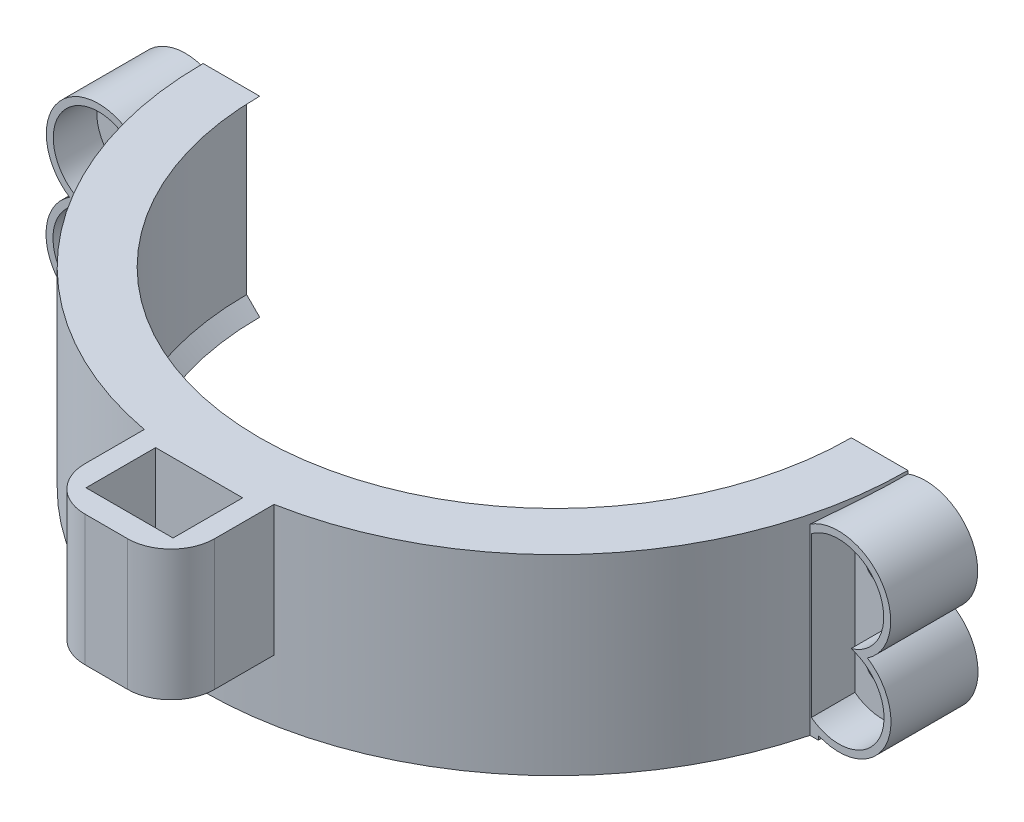
from build123d import *

# Parameters (mm, degrees)
REVOLVE1_ANGLE                  = 180
BOSS_EXTRUDE1_START             = -11
BOSS_EXTRUDE1_DEPTH             = 11
CUT_EXTRUDE1_REACH              = 68.374
BOSS_EXTRUDE2_REACH             = 67.327
BOSS_EXTRUDE2_END_RADIUS        = 40.5
SKETCH6_W                       = 25.4
SKETCH6_H                       = 18
BOSS_EXTRUDE2_DIRECTION_2_DEPTH = 15
SKETCH8_W                       = 4
SKETCH8_H                       = 19.884534
CUT_EXTRUDE3_DEPTH              = 80.722348
FILLET1_START                   = 2
FILLET1_DEPTH                   = 5
FILLET1_START_2                 = -11
FILLET1_2_DEPTH                 = 16.09884
FILLET1_START_3                 = 37
FILLET1_3_DEPTH                 = 28
FILLET1_START_4                 = 62
FILLET1_4_OUTLINE_W             = 4
FILLET1_4_OUTLINE_H             = 5
FILLET1_4_DEPTH                 = 3
FILLET1_START_5                 = 39.17071
FILLET1_5_OUTLINE_W             = 4
FILLET1_5_OUTLINE_H             = 5
FILLET1_5_DEPTH                 = 2.944756
FILLET1_6_DEPTH                 = 6
SKETCH9_R                       = 2
BOSS_EXTRUDE3_DEPTH             = 10
CUT_EXTRUDE4_DEPTH              = 75.187772
CUT_EXTRUDE4_DEPTH_BACK         = 5
CUT_EXTRUDE5_DEPTH              = 85.064413
SKETCH12_W                      = 14.911662
SKETCH12_H                      = 13.358131
SKETCH12_W_2                    = 10
SKETCH12_H_2                    = 8
BOSS_EXTRUDE4_DEPTH             = 15
FILLET2_R                       = 5


with BuildPart() as part:
    # Sketch2 → Revolve1 (revolve, symmetric)
    with BuildSketch(Plane(origin=(0, 0, 0), x_dir=(0, 0, -1), z_dir=(1, 0, 0))) as revolve1_sk:
        Polygon((-34, -11), (-35.5, -9.5), (-35.5, 9.5), (-34, 11), (-35.5, 11), (-40.5, 11), (-40.5, -11), (-35.5, -11), align=None)
    revolve(axis=Axis((0, 0, 0), (0, 1, 0)), revolution_arc=REVOLVE1_ANGLE / 2)
    revolve(revolve1_sk.sketch, axis=Axis((0, 0, 0), (0, -1, 0)), revolution_arc=REVOLVE1_ANGLE / 2)

    # Sketch3 → Boss-Extrude1 (add)
    with BuildSketch(Plane(origin=(0, 0, 0), x_dir=(1, 0, 0), z_dir=(0, 1, 0)).offset(BOSS_EXTRUDE1_START)):
        with BuildLine():
            ThreePointArc((-40.5, 0), (0, -40.5), (40.5, 0))
            add(Edge.make_bspline(
                [(40.5, 0), (41.574904, -20.679763), (31.861074, -51.110818), (0, -51.360442)],
                knots=[0, 0, 0, 0, 1, 1, 1, 1], degree=3))
            add(Edge.make_bspline(
                [(-40.5, 0), (-41.574904, -20.679763), (-31.861074, -51.110818), (0, -51.360442)],
                knots=[0, 0, 0, 0, 1, 1, 1, 1], degree=3))
        make_face()
    extrude(amount=BOSS_EXTRUDE1_DEPTH)

    # Sketch5 → Cut-Extrude1 (cut, up to next)
    with BuildSketch(Plane(origin=(0, 0, 0), x_dir=(1, 0, 0), z_dir=(0, 1, 0)), mode=Mode.PRIVATE) as cut_extrude1_sk1:
        Polygon((32.298595, -50), (-32.298595, -50), (-4.520904, -70.798059), align=None)
    cut_extrude1_tool1 = extrude(cut_extrude1_sk1.sketch, amount=-CUT_EXTRUDE1_REACH, mode=Mode.PRIVATE) & part.part
    add(cut_extrude1_tool1.solids().sort_by_distance((-1.506968, 0, 56.932686))[0], mode=Mode.SUBTRACT)

    # Boss-Extrude2: up to this cylinder (the profile starts outside it)
    boss_extrude2_end = Plane(origin=(0, -2, 0), z_dir=(0, -1, 0)) * Cylinder(BOSS_EXTRUDE2_END_RADIUS, 216.654, mode=Mode.PRIVATE)
    # Sketch6 → Boss-Extrude2 (add, up to the surface)
    with BuildSketch(Plane.XY.offset(50), mode=Mode.PRIVATE) as boss_extrude2_sk1:
        with Locations((0, -2)):
            Rectangle(SKETCH6_W, SKETCH6_H)
    boss_extrude2_tool1 = extrude(boss_extrude2_sk1.sketch, amount=-BOSS_EXTRUDE2_REACH, mode=Mode.PRIVATE) - boss_extrude2_end
    add(boss_extrude2_tool1.solids().sort_by_distance((0, -2, 50))[0])

    # Sketch6 → Boss-Extrude2 direction 2 (add)
    with BuildSketch(Plane.XY.offset(50)):
        with Locations((0, -2)):
            Rectangle(SKETCH6_W, SKETCH6_H)
    extrude(amount=BOSS_EXTRUDE2_DIRECTION_2_DEPTH)

    # Sketch8 → Cut-Extrude3 (cut, through all)
    with BuildSketch(Plane(origin=(0, 11, 0), x_dir=(1, 0, 0), z_dir=(0, 1, 0))):
        with BuildLine():
            Line((15.113165, -40.129156), (15.113165, -45.006528))
            add(Edge.make_bspline(
                [(15.113165, -45.006528), (20.553217, -43.096096), (30.745136, -32.716473), (33.442003, -26.840069)],
                knots=[0, 0, 0, 0, 1, 1, 1, 1], degree=3))
            ThreePointArc((33.442003, -26.840069), (25.17044, -34.716075), (15.113165, -40.129156))
        make_face()
        with BuildLine():
            Line((-15.113165, -40.129156), (-15.113165, -45.006528))
            add(Edge.make_bspline(
                [(-15.113165, -45.006528), (-20.553217, -43.096096), (-30.745136, -32.716473), (-33.442003, -26.840069)],
                knots=[0, 0, 0, 0, 1, 1, 1, 1], degree=3))
            ThreePointArc((-33.442003, -26.840069), (-25.17044, -34.716075), (-15.113165, -40.129156))
        make_face()
        with Locations((0, -52.057733)):
            Rectangle(SKETCH8_W, SKETCH8_H)
    extrude(amount=-CUT_EXTRUDE3_DEPTH, mode=Mode.SUBTRACT)

    # Fillet1: read off the stored shape, not the designer's step
    # Fillet1 outline → Fillet1 (cut)
    with BuildSketch(Plane(origin=(0, 0, 0), x_dir=(1, 0, 0), z_dir=(0, 1, 0)).offset(FILLET1_START)):
        with BuildLine():
            Line((-12.7, -65), (12.7, -65))
            Line((12.7, -65), (12.7, -38.457249))
            ThreePointArc((12.7, -38.457249), (0, -40.5), (-12.7, -38.457249))
            Line((-12.7, -38.457249), (-12.7, -65))
        make_face()
    extrude(amount=FILLET1_DEPTH, mode=Mode.SUBTRACT)

    # Fillet1 2 outline → Fillet1 2 (cut)
    with BuildSketch(Plane(origin=(0, 0, 0), x_dir=(1, 0, 0), z_dir=(0, 1, 0)).offset(FILLET1_START_2)):
        with BuildLine():
            Line((-12.7, -65), (-7.7, -65))
            add(Edge.make_bspline(
                [(-7.7, -65), (-12.7, -65), (-12.7, -60)],
                knots=[0, 0, 0, 1, 1, 1], degree=2, weights=[1, 0.707107, 1]))
            Line((-12.7, -60), (-12.7, -65))
        make_face()
        with BuildLine():
            add(Edge.make_bspline(
                [(7.7, -65), (12.7, -65), (12.7, -60)],
                knots=[0, 0, 0, 1, 1, 1], degree=2, weights=[1, 0.707107, 1]))
            Line((7.7, -65), (12.7, -65))
            Line((12.7, -65), (12.7, -60))
        make_face()
    extrude(amount=FILLET1_2_DEPTH, mode=Mode.SUBTRACT)

    # Fillet1 3 outline → Fillet1 3 (add)
    with BuildSketch(Plane.XY.offset(FILLET1_START_3)):
        with BuildLine():
            add(Edge.make_bspline(
                [(-12.7, 2), (-12.7, 7), (-7.7, 7)],
                knots=[0, 0, 0, 1, 1, 1], degree=2, weights=[1, 0.707107, 1]))
            Line((-12.7, 2), (-2, 2))
            Line((-2, 2), (-2, 7))
            Line((-2, 7), (-7.7, 7))
        make_face()
        with BuildLine():
            Line((2, 7), (2, 2))
            Line((2, 2), (12.7, 2))
            add(Edge.make_bspline(
                [(7.7, 7), (12.7, 7), (12.7, 2)],
                knots=[0, 0, 0, 1, 1, 1], degree=2, weights=[1, 0.707107, 1]))
            Line((7.7, 7), (2, 7))
        make_face()
    extrude(amount=FILLET1_3_DEPTH)

    # Fillet1 4 outline → Fillet1 4 (add)
    with BuildSketch(Plane.XY.offset(FILLET1_START_4)):
        with Locations((0, 4.5)):
            Rectangle(FILLET1_4_OUTLINE_W, FILLET1_4_OUTLINE_H)
    extrude(amount=FILLET1_4_DEPTH)

    # Fillet1 5 outline → Fillet1 5 (add)
    with BuildSketch(Plane.XY.offset(FILLET1_START_5)):
        with Locations((0, 4.5)):
            Rectangle(FILLET1_5_OUTLINE_W, FILLET1_5_OUTLINE_H)
    extrude(amount=FILLET1_5_DEPTH)

    # Fillet1 6 outline → Fillet1 6 (cut)
    with BuildSketch(Plane(origin=(0, 0, 0), x_dir=(1, 0, 0), z_dir=(0, 1, 0)).offset(FILLET1_START)):
        with BuildLine():
            Line((-12.7, -65), (-7.7, -65))
            add(Edge.make_bspline(
                [(-12.7, -60), (-12.7, -60.274102), (-12.679965, -60.548369), (-12.639842, -60.820553), (-12.536378, -61.284433), (-12.482162, -61.478121), (-12.41762, -61.668662), (-12.288664, -61.991396), (-12.22893, -62.125441), (-12.163988, -62.25706), (-11.922281, -62.702191), (-11.720174, -63.002028), (-11.490067, -63.281001), (-10.981001, -63.790067), (-10.702028, -64.020174), (-10.402191, -64.222281), (-9.95706, -64.463988), (-9.825441, -64.52893), (-9.691396, -64.588664), (-9.368662, -64.71762), (-9.178121, -64.782162), (-8.984433, -64.836378), (-8.520553, -64.939842), (-8.248369, -64.979965), (-7.974102, -65), (-7.7, -65)],
                knots=[0, 0, 0, 0, 0, 0.139857, 0.139857, 0.139857, 0.242164, 0.242164, 0.242164, 0.316823, 0.316823, 0.316823, 0.5, 0.5, 0.5, 0.683177, 0.683177, 0.683177, 0.757836, 0.757836, 0.757836, 0.860143, 0.860143, 0.860143, 1, 1, 1, 1, 1], degree=4))
            Line((-12.7, -60), (-12.7, -65))
        make_face()
        with BuildLine():
            Line((12.7, -65), (12.7, -60))
            add(Edge.make_bspline(
                [(12.7, -60), (12.7, -60.274102), (12.679965, -60.548369), (12.639842, -60.820553), (12.536378, -61.284433), (12.482162, -61.478121), (12.41762, -61.668662), (12.288664, -61.991396), (12.22893, -62.125441), (12.163988, -62.25706), (11.922281, -62.702191), (11.720174, -63.002028), (11.490067, -63.281001), (10.981001, -63.790067), (10.702028, -64.020174), (10.402191, -64.222281), (9.95706, -64.463988), (9.825441, -64.52893), (9.691396, -64.588664), (9.368662, -64.71762), (9.178121, -64.782162), (8.984433, -64.836378), (8.520553, -64.939842), (8.248369, -64.979965), (7.974102, -65), (7.7, -65)],
                knots=[0, 0, 0, 0, 0, 0.139857, 0.139857, 0.139857, 0.242164, 0.242164, 0.242164, 0.316823, 0.316823, 0.316823, 0.5, 0.5, 0.5, 0.683177, 0.683177, 0.683177, 0.757836, 0.757836, 0.757836, 0.860143, 0.860143, 0.860143, 1, 1, 1, 1, 1], degree=4))
            Line((7.7, -65), (12.7, -65))
        make_face()
    extrude(amount=FILLET1_6_DEPTH, mode=Mode.SUBTRACT)

    # Sketch9 → Boss-Extrude3 (add)
    # profile 1 of 2: a face of its own
    with BuildSketch(Plane.XY):
        with BuildLine():
            ThreePointArc((39.222943, -0.011905), (42.578982, -10.999961), (45.856052, 0.011905))
            ThreePointArc((45.856052, 0.011905), (42.500013, 10.999961), (39.222943, -0.011905))
        make_face()
        with Locations((42.557445, -5)):
            Circle(SKETCH9_R, mode=Mode.SUBTRACT)
        with Locations((42.52155, 5)):
            Circle(SKETCH9_R, mode=Mode.SUBTRACT)
    # profile 2 of 2: a face of its own
    with BuildSketch(Plane.XY):
        with BuildLine():
            ThreePointArc((-39.222943, -0.011905), (-42.578982, -10.999961), (-45.856052, 0.011905))
            ThreePointArc((-45.856052, 0.011905), (-42.500013, 10.999961), (-39.222943, -0.011905))
        make_face()
        with Locations(Location((-42.557445, -5, 0), (0, 0, 180))):
            Circle(SKETCH9_R, mode=Mode.SUBTRACT)
        with Locations(Location((-42.52155, 5, 0), (0, 0, 180))):
            Circle(SKETCH9_R, mode=Mode.SUBTRACT)
    extrude(amount=BOSS_EXTRUDE3_DEPTH)

    # Sketch10 → Cut-Extrude4 (cut, two sides: drawn at the far end of the back side and taken through both)
    with BuildSketch(Plane.XY.offset(10).offset(-CUT_EXTRUDE4_DEPTH_BACK)):
        with BuildLine():
            Line((39.407769, -9.137577), (39.407769, 9.164657))
            ThreePointArc((39.407769, 9.164657), (47.176604, 7.317427), (43.967661, 0.005126))
            ThreePointArc((43.967661, 0.005126), (47.210797, -7.320844), (39.407769, -9.137577))
        make_face()
        with BuildLine():
            Line((-39.407769, -9.137577), (-39.407769, 9.164657))
            ThreePointArc((-39.407769, 9.164657), (-47.176604, 7.317427), (-43.967661, 0.005126))
            ThreePointArc((-43.967661, 0.005126), (-47.210797, -7.320844), (-39.407769, -9.137577))
        make_face()
    extrude(amount=CUT_EXTRUDE4_DEPTH + CUT_EXTRUDE4_DEPTH_BACK, mode=Mode.SUBTRACT)

    # Sketch11 → Cut-Extrude5 (cut, through all)
    with BuildSketch(Plane(origin=(0, 11, 0), x_dir=(1, 0, 0), z_dir=(0, 1, 0))):
        with BuildLine():
            Line((48.52155, -10), (39.246019, -10))
            ThreePointArc((39.246019, -10), (0, -40.5), (-39.246019, -10))
            Line((-39.246019, -10), (-48.52155, -10))
            Line((-48.52155, -10), (-48.52155, -69.748878))
            Line((-48.52155, -69.748878), (48.52155, -69.748878))
            Line((48.52155, -69.748878), (48.52155, -10))
        make_face()
    extrude(amount=-CUT_EXTRUDE5_DEPTH, mode=Mode.SUBTRACT)

    # Sketch12 → Boss-Extrude4 (add)
    with BuildSketch(Plane(origin=(0, 11, 0), x_dir=(1, 0, 0), z_dir=(0, 1, 0))):
        with Locations((0, -44.956584)):
            Rectangle(SKETCH12_W, SKETCH12_H)
        with Locations((0, -44.956584)):
            Rectangle(SKETCH12_W_2, SKETCH12_H_2, mode=Mode.SUBTRACT)
    extrude(amount=-BOSS_EXTRUDE4_DEPTH)

    # Fillet2
    fillet2_edges = [part.edges().sort_by_distance(p)[0] for p in [
        (-7.455831, 3.5, 51.635649),
        (7.455831, 3.5, 51.635649),
    ]]
    fillet(fillet2_edges, radius=FILLET2_R)


solid = part.part
